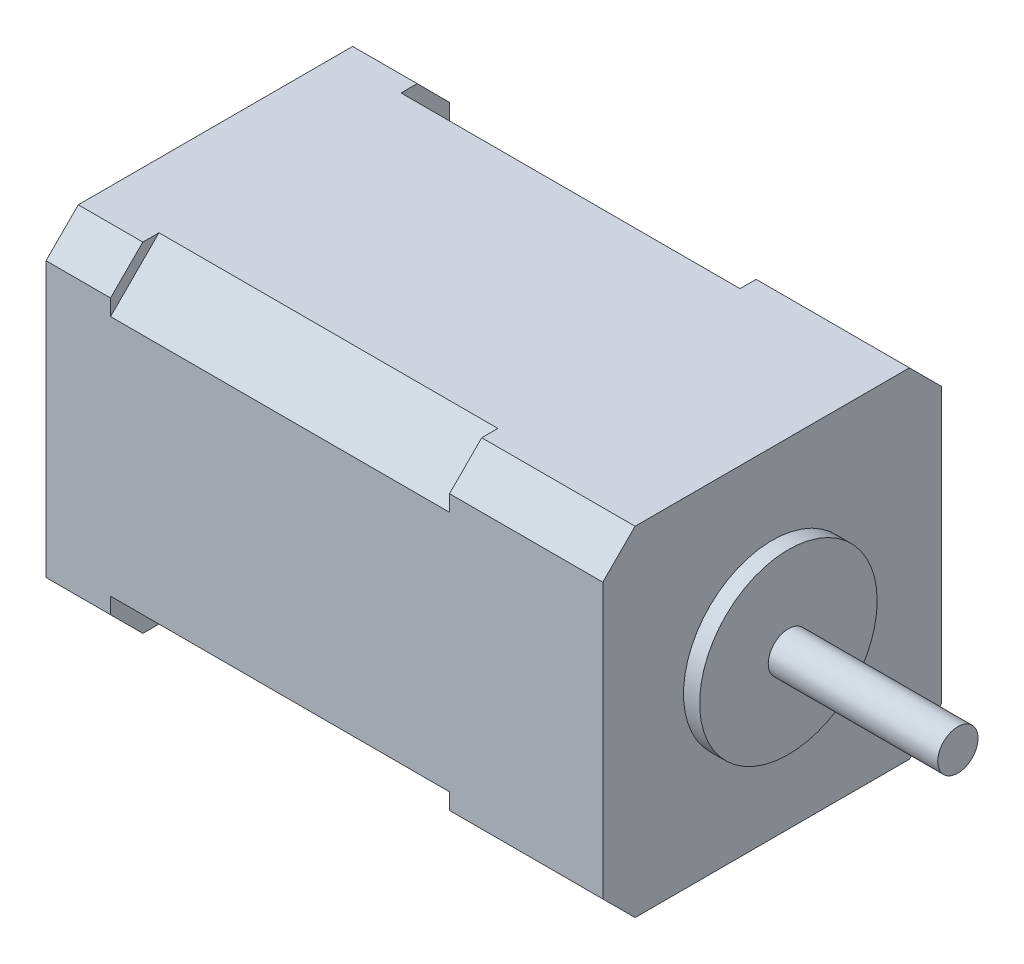
from build123d import *

# Parameters (mm, degrees)
SKETCH_1_W          = 42
SKETCH_1_H          = 42
EXTRUDE_1_DEPTH     = 69
SKETCH_2_R          = 11
EXTRUDE_2_DEPTH     = 2
SKETCH_3_R          = 2.5
EXTRUDE_3_DEPTH     = 21
CUT_EXTRUDE_START   = -8
CUT_EXTRUDE_1_DEPTH = 42
CHAMFER_1_SIZE      = 4


with BuildPart() as part:
    # 草图1 → 凸台-拉伸1 (new body)
    with BuildSketch(Plane(origin=(0, 0, 0), x_dir=(0, 0, -1), z_dir=(1, 0, 0))):
        Rectangle(SKETCH_1_W, SKETCH_1_H)
    extrude(amount=EXTRUDE_1_DEPTH)

    # 草图2 → 凸台-拉伸2 (add)
    with BuildSketch(Plane(origin=(69, 0, 0), x_dir=(0, 0, -1), z_dir=(1, 0, 0))):
        Circle(SKETCH_2_R)
    extrude(amount=EXTRUDE_2_DEPTH)

    # 草图3 → 凸台-拉伸3 (add)
    with BuildSketch(Plane(origin=(71, 0, 0), x_dir=(0, 0, -1), z_dir=(1, 0, 0))):
        Circle(SKETCH_3_R)
    extrude(amount=EXTRUDE_3_DEPTH)

    # 草图5 → 切除-拉伸1 (cut)
    with BuildSketch(Plane.ZY.offset(CUT_EXTRUDE_START)):
        Polygon((21, 15), (15, 21), (21, 21), align=None)
        Polygon((21, -21), (21, -15), (15, -21), align=None)
        Polygon((-21, 21), (-21, 15), (-15, 21), align=None)
        Polygon((-21, -15), (-15, -21), (-21, -21), align=None)
    extrude(amount=-CUT_EXTRUDE_1_DEPTH, mode=Mode.SUBTRACT)

    # 倒角1
    chamfer_1_edges = [part.edges().sort_by_distance(p)[0] for p in [
        (4, -21, -21),
        (59.5, -21, -21),
        (59.5, -21, 21),
        (4, -21, 21),
        (4, 21, 21),
        (4, 21, -21),
        (59.5, 21, -21),
        (59.5, 21, 21),
    ]]
    chamfer(chamfer_1_edges, length=CHAMFER_1_SIZE)


solid = part.part
